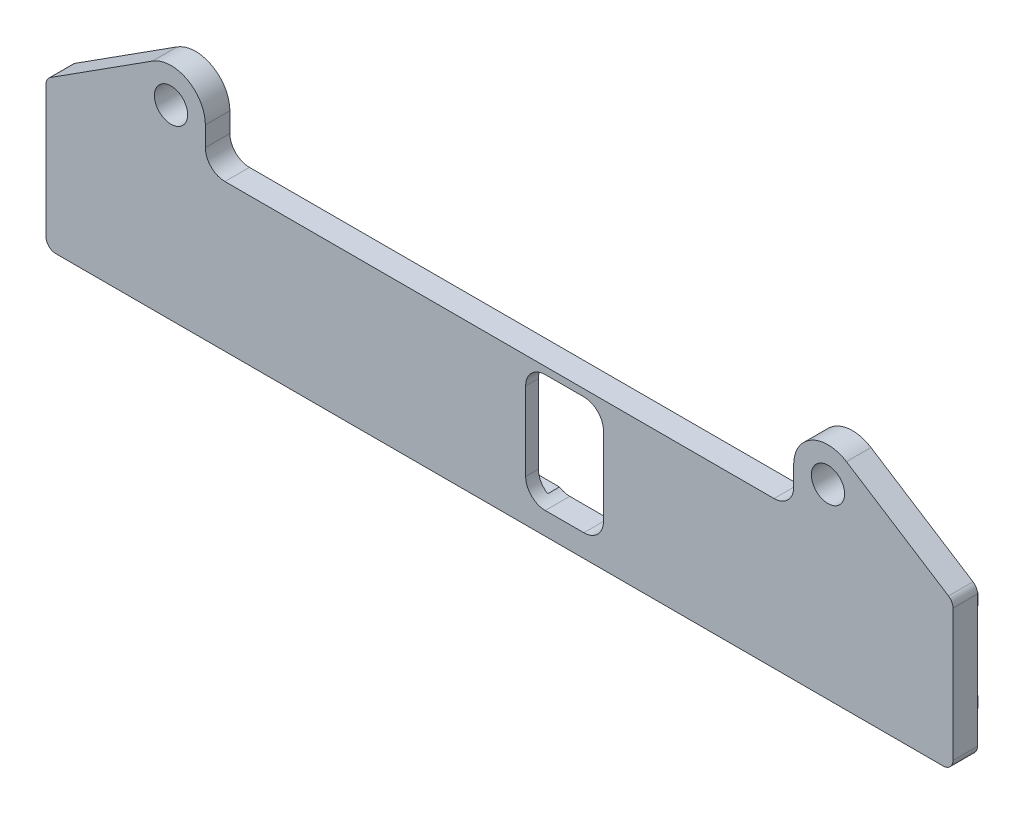
from build123d import *

# Parameters (mm, degrees)
BOSS_EXTRUDE1_DEPTH   = 3.175
F_6_CLEARANCE_HOLE1_D = 4.3053
FILLET3_R             = 1.27
SKETCH4_W             = 10.08
SKETCH4_H             = 15.24
CUT_EXTRUDE1_DEPTH    = 90.259997568
FILLET4_R             = 2.54
CUT_EXTRUDE2_DEPTH    = 1.524
BOSS_EXTRUDE2_DEPTH   = 1.524


with BuildPart() as part:
    # Sketch1 → Boss-Extrude1 (new body)
    with BuildSketch(Plane.XY):
        with BuildLine():
            Line((58.7375, -67.1354797), (58.7375, -48.0854797))
            Line((58.7375, -48.0854797), (44.939976119, -39.26086832))
            ThreePointArc((44.939976119, -39.26086832), (40.410479427, -39.106525106), (38.1, -43.0054797))
            Line((38.1, -43.0054797), (38.1, -45.5454797))
            ThreePointArc((38.1, -45.5454797), (37.356051224, -47.341530924), (35.56, -48.0854797))
            Line((35.56, -48.0854797), (-35.56, -48.0854797))
            ThreePointArc((-35.56, -48.0854797), (-37.356051224, -47.341530924), (-38.1, -45.5454797))
            Line((-38.1, -45.5454797), (-38.1, -43.0054797))
            ThreePointArc((-38.1, -43.0054797), (-40.410479427, -39.106525106), (-44.939976119, -39.26086832))
            Line((-44.939976119, -39.26086832), (-58.7375, -48.0854797))
            Line((-58.7375, -48.0854797), (-58.7375, -67.1354797))
            Line((-58.7375, -67.1354797), (58.7375, -67.1354797))
        make_face()
    extrude(amount=BOSS_EXTRUDE1_DEPTH)

    # #6 Clearance Hole1 (through all)
    with Locations(Plane(origin=(0, 0, 0), x_dir=(-1, 0, 0), z_dir=(0, 0, -1))):
        with Locations((42.545, -43.0054797), (-42.545, -43.0054797)):
            Hole(F_6_CLEARANCE_HOLE1_D / 2)

    # Fillet3
    fillet3_edges = [part.edges().sort_by_distance(p)[0] for p in [
        (58.7375, -67.1354797, 1.5875),
        (58.7375, -48.0854797, 1.5875),
        (-58.7375, -48.0854797, 1.5875),
        (-58.7375, -67.1354797, 1.5875),
    ]]
    fillet(fillet3_edges, radius=FILLET3_R)

    # Sketch4 → Cut-Extrude1 (cut, through all)
    with BuildSketch(Plane.XY.offset(3.175)):
        with Locations((8.426666963, -56.6198797)):
            Rectangle(SKETCH4_W, SKETCH4_H)
    extrude(amount=-CUT_EXTRUDE1_DEPTH, mode=Mode.SUBTRACT)

    # Fillet4
    fillet4_edges = [part.edges().sort_by_distance(p)[0] for p in [
        (3.386666963, -64.2398797, 1.5875),
        (13.466666963, -64.2398797, 1.5875),
        (13.466666963, -48.9998797, 1.5875),
        (3.386666963, -48.9998797, 1.5875),
    ]]
    fillet(fillet4_edges, radius=FILLET4_R)

    # Sketch7 → Cut-Extrude2 (cut)
    with BuildSketch(Plane(origin=(0, 0, 0), x_dir=(-1, 0, 0), z_dir=(0, 0, -1))):
        Polygon((58.039, -60.872510434), (58.039, -52.367248965), (55.052630735, -49.3808797), (-55.052631243, -49.3808797), (-58.039000508, -52.367248965), (-58.039000508, -60.872510434), (-55.052631243, -63.8588797), (55.052630735, -63.8588797), align=None)
    extrude(amount=-CUT_EXTRUDE2_DEPTH, mode=Mode.SUBTRACT)

    # Sketch5 → Boss-Extrude2 (add)
    with BuildSketch(Plane(origin=(0, 0, 0), x_dir=(-1, 0, 0), z_dir=(0, 0, -1))):
        Polygon((-55.814631243, -50.1428797), (-57.277000508, -50.1428797), (-57.277000508, -51.605248965), align=None)
        Polygon((-55.814631243, -63.0968797), (-57.277000508, -63.0968797), (-57.277000508, -61.634510434), align=None)
        Polygon((57.277, -61.634510434), (57.277, -63.0968797), (55.814630735, -63.0968797), align=None)
        Polygon((55.814630735, -50.1428797), (57.277, -50.1428797), (57.277, -51.605248965), align=None)
    extrude(amount=BOSS_EXTRUDE2_DEPTH)


solid = part.part
